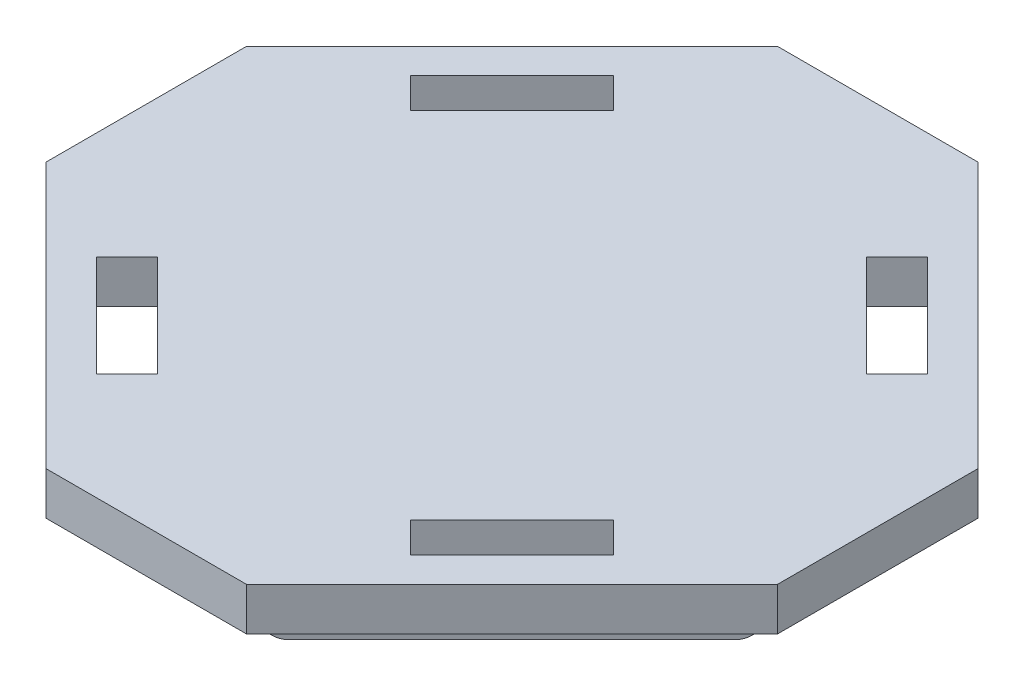
from build123d import *

# Parameters (mm, degrees)
MAIN_PLATE_DEPTH                 = 3
TOP_PLATE_CONNECTOR_HOLES_DEPTH  = 37.224942593
ZIPTIE_STRUCTURE_DEPTH           = 6
SKETCH5_W                        = 7.5
SKETCH5_H                        = 3
ZIPTIE_HOLES_DEPTH               = 52.45154631
REMOVING_STRESS_CONCENTRATIONS_R = 1.5


with BuildPart() as part:
    # Sketch1 → Main Plate (new body)
    with BuildSketch(Plane(origin=(0, 0, 0), x_dir=(1, 0, 0), z_dir=(0, 1, 0))):
        Polygon((-7, 25.526911935), (7, 25.526911935), (25.526911935, 7), (25.526911935, -7), (7, -25.526911935), (-7, -25.526911935), (-25.526911935, -7), (-25.526911935, 7), align=None)
    extrude(amount=MAIN_PLATE_DEPTH)

    # Sketch2 → Top Plate Connector Holes (cut, through all)
    with BuildSketch(Plane.XZ):
        Polygon((10.960155108, 18.03122292), (18.03122292, 10.960155108), (15.909902577, 8.838834765), (8.838834765, 15.909902577), align=None)
        Polygon((8.838834765, -15.909902577), (15.909902577, -8.838834765), (18.03122292, -10.960155108), (10.960155108, -18.03122292), align=None)
        Polygon((-15.909902577, -8.838834765), (-8.838834765, -15.909902577), (-10.960155108, -18.03122292), (-18.03122292, -10.960155108), align=None)
        Polygon((-8.838834765, 15.909902577), (-15.909902577, 8.838834765), (-18.03122292, 10.960155108), (-10.960155108, 18.03122292), align=None)
    extrude(amount=-TOP_PLATE_CONNECTOR_HOLES_DEPTH, mode=Mode.SUBTRACT)

    # Sketch3 → ZipTie Structure (add)
    with BuildSketch(Plane.XZ):
        Polygon((1.767766953, 19.445436483), (19.445436483, 1.767766953), (17.324116139, -0.353553391), (-0.353553391, 17.324116139), align=None)
        Polygon((-1.767766953, -19.445436483), (0.353553391, -17.324116139), (-17.324116139, 0.353553391), (-19.445436483, -1.767766953), align=None)
    extrude(amount=ZIPTIE_STRUCTURE_DEPTH)

    # Sketch5 → ZipTie Holes (cut, through all)
    with BuildSketch(Plane(origin=(-10.606601718, 0, -10.606601718), x_dir=(-0.7071067811865475, 0, 0.7071067811865477), z_dir=(-0.7071067811865477, 0, -0.7071067811865475))):
        with Locations((-5.75, -1.5)):
            Rectangle(SKETCH5_W, SKETCH5_H)
        with Locations((5.75, -1.5)):
            Rectangle(SKETCH5_W, SKETCH5_H)
    extrude(amount=-ZIPTIE_HOLES_DEPTH, mode=Mode.SUBTRACT)

    # Removing Stress Concentrations
    removing_stress_concentrations_edges = [part.edges().sort_by_distance(p)[0] for p in [
        (8.131727984, -3, 10.960155108),
        (10.960155108, -3, 8.131727984),
        (16.263455967, -3, 2.828427125),
        (-2.828427125, -3, -16.263455967),
        (-8.131727984, -3, -10.960155108),
        (-10.960155108, -3, -8.131727984),
        (-16.263455967, -3, -2.828427125),
        (2.828427125, -3, 16.263455967),
        (-16.263455967, 0, -2.828427125),
        (-8.131727984, 0, -10.960155108),
        (-0.707106781, 0, -18.384776311),
        (2.828427125, 0, 18.384776311),
        (10.606601718, 0, 10.606601718),
        (18.384776311, 0, 2.828427125),
        (10.960155108, 0, 8.131727984),
        (2.828427125, 0, 16.263455967),
        (0.707106781, -6, 18.384776311),
        (18.384776311, -6, 0.707106781),
        (18.384776311, 0, 0.707106781),
        (16.263455967, 0, 2.828427125),
        (0.707106781, 0, 18.384776311),
        (8.131727984, 0, 10.960155108),
        (-18.384776311, 0, -0.707106781),
        (-2.828427125, 0, -16.263455967),
        (-10.960155108, 0, -8.131727984),
        (-2.828427125, 0, -18.384776311),
        (-10.606601718, 0, -10.606601718),
        (-18.384776311, 0, -2.828427125),
        (-18.384776311, -6, -0.707106781),
        (-0.707106781, -6, -18.384776311),
    ]]
    fillet(removing_stress_concentrations_edges, radius=REMOVING_STRESS_CONCENTRATIONS_R - 0.0001)  # a hair under: the kernel refuses the full size


solid = part.part
